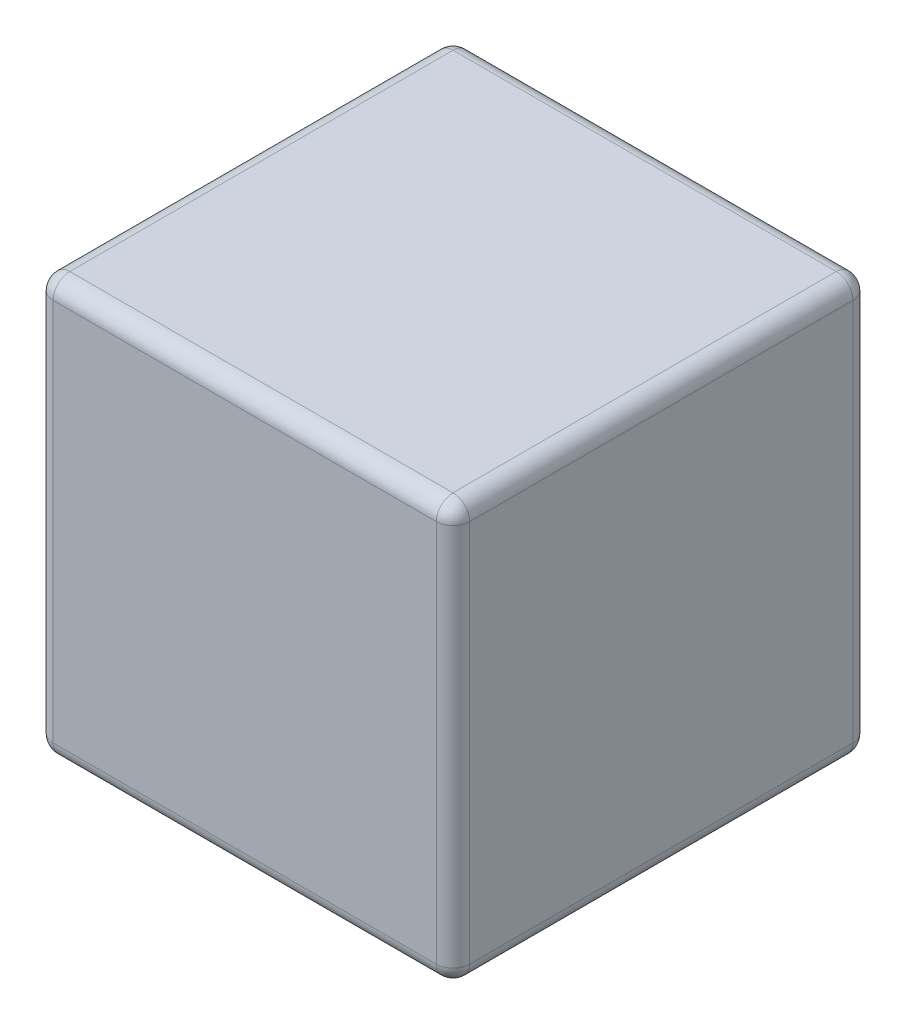
from build123d import *

# Parameters (mm, degrees)
SKETCH1_W           = 250
SKETCH1_H           = 250
BOSS_EXTRUDE1_DEPTH = 125
FILLET1_R           = 10
SKETCH2_W           = 2.243589744
SKETCH2_H           = 25
CUT_EXTRUDE1_DEPTH  = 15


with BuildPart() as part:
    # Sketch1 → Boss-Extrude1 (new, symmetric)
    with BuildSketch(Plane(origin=(0, 0, 0), x_dir=(1, 0, 0), z_dir=(0, 1, 0))):
        Rectangle(SKETCH1_W, SKETCH1_H)
    extrude(amount=BOSS_EXTRUDE1_DEPTH, both=True)

    # Fillet1
    fillet1_edges = [part.edges().sort_by_distance(p)[0] for p in [
        (-125, 0, -125),
        (0, -125, -125),
        (-125, -125, 0),
        (125, 0, -125),
        (125, -125, 0),
        (-125, 0, 125),
        (125, 0, 125),
        (0, -125, 125),
        (0, 125, 125),
        (-125, 125, 0),
        (0, 125, -125),
        (125, 125, 0),
    ]]
    fillet(fillet1_edges, radius=FILLET1_R)

    # Sketch2 → Cut-Extrude1 (cut)
    # profile 1 of 11: a face of its own
    with BuildSketch(Plane(origin=(0, 0, -125), x_dir=(-1, 0, 0), z_dir=(0, 0, -1))):
        Polygon((-103.958881832, 105.864219876), (-101.715292089, 105.864219876), (-101.715292089, 83.42832244), (-92.099907473, 83.42832244), (-92.099907473, 80.864219876), (-103.958881832, 80.864219876), align=None)
    # profile 2 of 11: a face of its own
    with BuildSketch(Plane(origin=(0, 0, -125), x_dir=(-1, 0, 0), z_dir=(0, 0, -1))):
        with Locations((-86.811445935, 93.364219876)):
            Rectangle(SKETCH2_W, SKETCH2_H)
    # profile 3 of 11: a face of its own
    with BuildSketch(Plane(origin=(0, 0, -125), x_dir=(-1, 0, 0), z_dir=(0, 0, -1))):
        Polygon((-79.279394653, 105.864219876), (-67.099907473, 105.864219876), (-67.099907473, 103.300117312), (-77.035804909, 103.300117312), (-77.035804909, 95.60780962), (-67.099907473, 95.60780962), (-67.099907473, 93.043707055), (-77.035804909, 93.043707055), (-77.035804909, 80.864219876), (-79.279394653, 80.864219876), align=None)
    # profile 4 of 11: a face of its own
    with BuildSketch(Plane(origin=(0, 0, -125), x_dir=(-1, 0, 0), z_dir=(0, 0, -1))):
        Polygon((-62.612727986, 105.864219876), (-48.510163884, 105.864219876), (-48.510163884, 103.300117312), (-60.369138243, 103.300117312), (-60.369138243, 95.60780962), (-48.510163884, 95.60780962), (-48.510163884, 93.043707055), (-60.369138243, 93.043707055), (-60.369138243, 83.42832244), (-48.510163884, 83.42832244), (-48.510163884, 80.864219876), (-62.612727986, 80.864219876), align=None)
    # profile 5 of 11: a face of its own
    with BuildSketch(Plane(origin=(0, 0, -125), x_dir=(-1, 0, 0), z_dir=(0, 0, -1))):
        with BuildLine():
            Line((-36.971702345, 85.686936222), (-34.858320935, 86.953963466))
            add(Edge.make_bspline(
                [(-34.858320935, 86.953963466), (-34.661762098, 86.624932145), (-34.28516295, 85.994520831), (-33.656938956, 85.142677685), (-33.005989591, 84.41866228), (-32.327494351, 83.826686512), (-31.625594722, 83.360623035), (-30.895708624, 83.030607094), (-30.14029569, 82.824778698), (-29.626196965, 82.79977808), (-29.369538884, 82.787296799)],
                knots=[0, 0, 0, 0, 1.272034388, 2.437168799, 3.508375237, 4.49857839, 5.41946034, 6.295179144, 7.148887113, 8, 8, 8, 8], degree=3))
            add(Edge.make_bspline(
                [(-29.369538884, 82.787296799), (-29.150347023, 82.793401603), (-28.715798644, 82.80550439), (-28.076068337, 82.921795833), (-27.45476975, 83.100453897), (-26.864708051, 83.356317694), (-26.314025091, 83.665878306), (-25.831120124, 84.039779574), (-25.413647887, 84.458395329), (-25.072154211, 84.925414291), (-24.810153959, 85.427679638), (-24.608782042, 85.943222147), (-24.497031516, 86.480140492), (-24.480197563, 86.841643798), (-24.471702345, 87.024075645)],
                knots=[0, 0, 0, 0, 1.095163259, 2.171163733, 3.241058638, 4.321873601, 5.38011039, 6.391990106, 7.366004449, 8.327778327, 9.272591725, 10.192022065, 11.087607919, 12, 12, 12, 12], degree=3))
            add(Edge.make_bspline(
                [(-24.471702345, 87.024075645), (-24.482233136, 87.232224572), (-24.503640695, 87.655360923), (-24.684579838, 88.279644158), (-24.969217315, 88.89744823), (-25.231807628, 89.279600127), (-25.36813664, 89.478001927)],
                knots=[0, 0, 0, 0, 0.938893495, 1.908633276, 2.914225137, 4, 4, 4, 4], degree=3))
            add(Edge.make_bspline(
                [(-25.36813664, 89.478001927), (-25.480069599, 89.621193524), (-25.715058844, 89.921806371), (-26.119041076, 90.369272339), (-26.59308475, 90.830832474), (-27.120967285, 91.324111453), (-27.72191792, 91.826167143), (-28.377114451, 92.360940557), (-29.103284872, 92.908094679), (-29.612566991, 93.275041576), (-29.875348179, 93.464380132)],
                knots=[0, 0, 0, 0, 0.722233717, 1.516239348, 2.393582979, 3.351407094, 4.387010283, 5.505090956, 6.712668013, 8, 8, 8, 8], degree=3))
            add(Edge.make_bspline(
                [(-29.875348179, 93.464380132), (-30.138376723, 93.651727187), (-30.64126727, 94.009920489), (-31.344542858, 94.541522517), (-31.973431879, 95.027550157), (-32.52513914, 95.472578815), (-32.999421975, 95.876668848), (-33.400017768, 96.235939842), (-33.716721747, 96.560108134), (-33.892833038, 96.770403432), (-33.971902666, 96.864820837)],
                knots=[0, 0, 0, 0, 1.452282411, 2.77665338, 3.964542531, 5.026858415, 5.96415736, 6.766646006, 7.446254459, 8, 8, 8, 8], degree=3))
            add(Edge.make_bspline(
                [(-33.971902666, 96.864820837), (-34.082420846, 97.011971101), (-34.29976968, 97.301361842), (-34.586669719, 97.753682255), (-34.830520882, 98.216705579), (-35.021680397, 98.69167604), (-35.182653389, 99.171925532), (-35.290924322, 99.663720144), (-35.358720014, 100.164853133), (-35.365662775, 100.502092423), (-35.369138243, 100.670910581)],
                knots=[0, 0, 0, 0, 1.068054152, 2.10047183, 3.106115577, 4.101338837, 5.06977816, 6.043150881, 7.020423561, 8, 8, 8, 8], degree=3))
            add(Edge.make_bspline(
                [(-35.369138243, 100.670910581), (-35.359815321, 100.935408971), (-35.341368749, 101.458752283), (-35.185365055, 102.223258215), (-34.9391301, 102.953161195), (-34.594166615, 103.641235007), (-34.149471237, 104.269563442), (-33.634857135, 104.845374064), (-33.021917947, 105.329435365), (-32.34939921, 105.752378639), (-31.613282266, 106.083420962), (-30.841918671, 106.333142249), (-30.034082442, 106.474636947), (-29.486917194, 106.494942411), (-29.209282473, 106.505245517)],
                knots=[0, 0, 0, 0, 1.005424448, 1.989358655, 2.955360095, 3.929531133, 4.905563448, 5.876582895, 6.856512386, 7.866279853, 8.892233794, 9.918561126, 10.94386622, 12, 12, 12, 12], degree=3))
            add(Edge.make_bspline(
                [(-29.209282473, 106.505245517), (-28.914681757, 106.495084434), (-28.328814959, 106.474877283), (-27.467034848, 106.299180631), (-26.637315445, 106.008461547), (-25.969863553, 105.678542561), (-25.447486686, 105.349032449), (-25.049110024, 105.048890847), (-24.645413947, 104.703354357), (-24.233142126, 104.311502599), (-23.819280273, 103.869740092), (-23.397684186, 103.381092314), (-22.96736798, 102.848545486), (-22.690540408, 102.468370481), (-22.548625422, 102.273474684)],
                knots=[0, 0, 0, 0, 1.286793592, 2.559021753, 3.825965368, 5.121522368, 5.803751409, 6.523245864, 7.299691795, 8.125521123, 9.008227632, 9.944561021, 10.946284179, 12, 12, 12, 12], degree=3))
            Line((-22.548625422, 102.273474684), (-24.576870614, 100.736014748))
            add(Edge.make_bspline(
                [(-24.576870614, 100.736014748), (-24.699341561, 100.893791108), (-24.935191968, 101.197631488), (-25.293259732, 101.623140885), (-25.630750074, 102.011830025), (-25.96325293, 102.349438082), (-26.27320744, 102.65445332), (-26.574043456, 102.91559444), (-26.861431679, 103.135420122), (-27.223695327, 103.370016979), (-27.678821886, 103.602563433), (-28.250140002, 103.799342562), (-28.847184824, 103.917593004), (-29.253825049, 103.933227915), (-29.459683114, 103.941142953)],
                knots=[0, 0, 0, 0, 1.181633172, 2.275549214, 3.290209073, 4.226197932, 5.078386478, 5.862611352, 6.581680152, 7.217281963, 8.414376989, 9.595101626, 10.782541182, 12, 12, 12, 12], degree=3))
            add(Edge.make_bspline(
                [(-29.459683114, 103.941142953), (-29.717943989, 103.932487953), (-30.215975756, 103.915797602), (-30.923048871, 103.733511992), (-31.55943405, 103.446498705), (-32.106238086, 103.044248861), (-32.561502208, 102.567670342), (-32.890826913, 102.019249948), (-33.089042375, 101.413661358), (-33.113230086, 100.991220956), (-33.125548499, 100.77607885)],
                knots=[0, 0, 0, 0, 1.14458467, 2.207223713, 3.21896685, 4.227309161, 5.202851033, 6.127160689, 7.046193047, 8, 8, 8, 8], degree=3))
            add(Edge.make_bspline(
                [(-33.125548499, 100.77607885), (-33.122740452, 100.642139718), (-33.117119765, 100.374042436), (-33.038728353, 99.977960851), (-32.938018861, 99.582879855), (-32.778428634, 99.190575692), (-32.558105037, 98.794187413), (-32.268782352, 98.386889287), (-31.904401551, 97.965091368), (-31.625280034, 97.690752984), (-31.477912281, 97.545910581)],
                knots=[0, 0, 0, 0, 0.858281714, 1.717966888, 2.583508476, 3.4729293, 4.427298488, 5.488583878, 6.674047936, 8, 8, 8, 8], degree=3))
            add(Edge.make_bspline(
                [(-31.477912281, 97.545910581), (-31.423188193, 97.497074682), (-31.293176284, 97.381051766), (-31.055491101, 97.191106904), (-30.74161397, 96.956801388), (-30.359741105, 96.666891984), (-29.902831378, 96.330595826), (-29.370834549, 95.952212882), (-28.769680743, 95.519459604), (-28.343095629, 95.216905742), (-28.117535679, 95.056928209)],
                knots=[0, 0, 0, 0, 0.420754252, 0.999615792, 1.744751191, 2.668019286, 3.750313428, 4.999500688, 6.413464383, 8, 8, 8, 8], degree=3))
            add(Edge.make_bspline(
                [(-28.117535679, 95.056928209), (-27.846207726, 94.859489927), (-27.320818752, 94.477178057), (-26.57326461, 93.902780343), (-25.895451695, 93.341010567), (-25.285000241, 92.795456231), (-24.735879466, 92.270255566), (-24.254181462, 91.759089993), (-23.834998031, 91.265621616), (-23.383717899, 90.632960361), (-22.922590616, 89.855952617), (-22.526579849, 88.903965198), (-22.276877367, 87.948277195), (-22.244223686, 87.305942649), (-22.228112602, 86.989019555)],
                knots=[0, 0, 0, 0, 1.163667725, 2.253281268, 3.268753668, 4.215851969, 5.092017293, 5.902905408, 6.650798638, 7.335211899, 8.59617414, 9.77448103, 10.901945474, 12, 12, 12, 12], degree=3))
            add(Edge.make_bspline(
                [(-22.228112602, 86.989019555), (-22.232806445, 86.764888376), (-22.242102982, 86.320978494), (-22.348966651, 85.669156516), (-22.505535688, 85.036078875), (-22.741515931, 84.429570929), (-23.02953849, 83.83853691), (-23.395011689, 83.278480479), (-23.818638008, 82.737006203), (-24.304593472, 82.228552693), (-24.836349917, 81.761794151), (-25.398376308, 81.346586569), (-25.991592543, 81.000384259), (-26.612780519, 80.717878244), (-27.262082924, 80.496924547), (-27.93928138, 80.336832625), (-28.645492175, 80.238577547), (-29.125495614, 80.228379251), (-29.369538884, 80.223194235)],
                knots=[0, 0, 0, 0, 0.983748083, 1.948392443, 2.894712957, 3.844097841, 4.80183111, 5.778335162, 6.776009319, 7.81870978, 8.863265674, 9.881300176, 10.883814829, 11.87499822, 12.874611388, 13.892143829, 14.928324115, 16, 16, 16, 16], degree=3))
            add(Edge.make_bspline(
                [(-29.369538884, 80.223194235), (-29.558362762, 80.226845532), (-29.933632477, 80.234102142), (-30.488700205, 80.298254145), (-31.032554413, 80.389019171), (-31.558370713, 80.53311967), (-32.072923654, 80.707955221), (-32.573975329, 80.923229025), (-33.061768571, 81.181209035), (-33.53903702, 81.476173497), (-34.004566838, 81.819443101), (-34.453991609, 82.21925379), (-34.90205722, 82.664578826), (-35.335538622, 83.167511421), (-35.763203939, 83.719926299), (-36.17662115, 84.326991894), (-36.584347704, 84.985401564), (-36.840172475, 85.448723605), (-36.971702345, 85.686936222)],
                knots=[0, 0, 0, 0, 0.915332311, 1.819136955, 2.706846663, 3.586547465, 4.459518054, 5.340707479, 6.227863349, 7.133153174, 8.059268498, 9.028702269, 10.047606654, 11.120612155, 12.245963614, 13.433783089, 14.680604001, 16, 16, 16, 16], degree=3))
        make_face()
    # profile 6 of 11: a face of its own
    with BuildSketch(Plane(origin=(0, 0, -125), x_dir=(-1, 0, 0), z_dir=(0, 0, -1))):
        with BuildLine():
            Line((-17.099907473, 105.864219876), (-14.85631773, 105.864219876))
            Line((-14.85631773, 105.864219876), (-14.85631773, 90.88525353))
            add(Edge.make_bspline(
                [(-14.85631773, 90.88525353), (-14.856651615, 90.673248274), (-14.857285221, 90.270931768), (-14.853052979, 89.69830105), (-14.841200347, 89.189212056), (-14.833727779, 88.741702431), (-14.817103968, 88.357825663), (-14.80354649, 88.035502016), (-14.786113942, 87.776257712), (-14.765163103, 87.624965383), (-14.756157473, 87.559933017)],
                knots=[0, 0, 0, 0, 1.528628734, 2.90083645, 4.128790002, 5.200304208, 6.127813768, 6.898992206, 7.526736466, 8, 8, 8, 8], degree=3))
            add(Edge.make_bspline(
                [(-14.756157473, 87.559933017), (-14.719175625, 87.325313279), (-14.647295722, 86.869293785), (-14.46410731, 86.219948915), (-14.208268017, 85.634724213), (-13.905103426, 85.095357848), (-13.505584774, 84.616862419), (-13.026988093, 84.176064899), (-12.447146889, 83.790552008), (-11.802428277, 83.43804621), (-11.107533724, 83.154724193), (-10.39745325, 82.940485876), (-9.682860541, 82.809922306), (-9.204459362, 82.794804171), (-8.966894653, 82.787296799)],
                knots=[0, 0, 0, 0, 1.035780045, 2.013197591, 2.933192213, 3.817615948, 4.702609284, 5.640816605, 6.646850145, 7.73207398, 8.84249596, 9.914020372, 10.964143139, 12, 12, 12, 12], degree=3))
            add(Edge.make_bspline(
                [(-8.966894653, 82.787296799), (-8.762939364, 82.794967158), (-8.356206779, 82.810263575), (-7.751875132, 82.904988082), (-7.163302927, 83.075706408), (-6.587583785, 83.295990397), (-6.047933896, 83.587044619), (-5.544052167, 83.923264901), (-5.09430978, 84.317628301), (-4.68389551, 84.754059333), (-4.326503111, 85.246486476), (-4.016709242, 85.784187462), (-3.762952602, 86.375254226), (-3.63764171, 86.790642956), (-3.573264845, 87.004043594)],
                knots=[0, 0, 0, 0, 0.994687771, 1.983630487, 2.973142513, 3.978332533, 4.983357753, 5.956394766, 6.925816176, 7.893390482, 8.871859704, 9.88551698, 10.913711441, 12, 12, 12, 12], degree=3))
            add(Edge.make_bspline(
                [(-3.573264845, 87.004043594), (-3.551835379, 87.092247696), (-3.504081892, 87.288801983), (-3.459460142, 87.621096915), (-3.41298496, 88.013163801), (-3.380738032, 88.467819606), (-3.349300743, 88.983540839), (-3.33049308, 89.563014107), (-3.321799988, 90.204135256), (-3.319209414, 90.651543554), (-3.317856191, 90.88525353)],
                knots=[0, 0, 0, 0, 0.558680831, 1.244966039, 2.062412453, 2.990489873, 4.051219941, 5.244515665, 6.560634259, 8, 8, 8, 8], degree=3))
            Line((-3.317856191, 90.88525353), (-3.317856191, 105.864219876))
            Line((-3.317856191, 105.864219876), (-1.074266448, 105.864219876))
            Line((-1.074266448, 105.864219876), (-1.074266448, 90.765061222))
            add(Edge.make_bspline(
                [(-1.074266448, 90.765061222), (-1.076081593, 90.492929944), (-1.07962396, 89.961849209), (-1.110342364, 89.183625216), (-1.159320934, 88.445389635), (-1.228521563, 87.747043231), (-1.320214443, 87.091084951), (-1.422180303, 86.471765178), (-1.552034111, 85.893529517), (-1.703701262, 85.351869391), (-1.877083748, 84.83625858), (-2.101663379, 84.346911333), (-2.354695522, 83.868951335), (-2.654800185, 83.409607701), (-2.992024347, 82.966846607), (-3.373822067, 82.543353214), (-3.787566073, 82.132360026), (-4.240134356, 81.744409554), (-4.724066679, 81.38863329), (-5.237923519, 81.075792068), (-5.777757589, 80.811337658), (-6.342165633, 80.593652483), (-6.931388511, 80.429976775), (-7.54544108, 80.308011376), (-8.185721032, 80.238709251), (-8.621182862, 80.228409751), (-8.841694332, 80.223194235)],
                knots=[0, 0, 0, 0, 1.316592851, 2.569410997, 3.76748051, 4.895814652, 5.963796859, 6.97159953, 7.931736103, 8.829262218, 9.692595152, 10.560224239, 11.431080259, 12.30701507, 13.211635791, 14.121146779, 15.063487852, 16.031507147, 17.00238618, 17.966455255, 18.938106653, 19.907068911, 20.888905087, 21.893141452, 22.933117798, 24, 24, 24, 24], degree=3))
            add(Edge.make_bspline(
                [(-8.841694332, 80.223194235), (-9.082187923, 80.228799701), (-9.554035486, 80.239797606), (-10.249307395, 80.302817249), (-10.915837369, 80.421520066), (-11.560665062, 80.572662521), (-12.17501147, 80.781117787), (-12.767107501, 81.024675822), (-13.326812366, 81.32379911), (-13.863206142, 81.65660906), (-14.3619544, 82.031070761), (-14.819792994, 82.439214861), (-15.237477784, 82.874503271), (-15.607968472, 83.341648741), (-15.937403362, 83.837018076), (-16.221190601, 84.362012646), (-16.46485663, 84.91642919), (-16.590617823, 85.301809193), (-16.654194332, 85.496631735)],
                knots=[0, 0, 0, 0, 1.13879206, 2.234305948, 3.301075583, 4.341971843, 5.366689343, 6.369221514, 7.369726634, 8.367512178, 9.355451585, 10.318319045, 11.268648973, 12.207971039, 13.137398894, 14.081662264, 15.030215811, 16, 16, 16, 16], degree=3))
            add(Edge.make_bspline(
                [(-16.654194332, 85.496631735), (-16.691174034, 85.629721552), (-16.771383829, 85.918396331), (-16.857278812, 86.396156963), (-16.929486538, 86.946263518), (-16.997383383, 87.568753649), (-17.037447368, 88.264109839), (-17.07257193, 89.032030667), (-17.100154922, 89.873444679), (-17.099992262, 90.459548362), (-17.099907473, 90.765061222)],
                knots=[0, 0, 0, 0, 0.625038921, 1.35572334, 2.194682327, 3.136881307, 4.189498639, 5.346923369, 6.617055217, 8, 8, 8, 8], degree=3))
            Line((-17.099907473, 90.765061222), (-17.099907473, 105.864219876))
        make_face()
    # profile 7 of 11: a face of its own
    with BuildSketch(Plane(origin=(0, 0, -125), x_dir=(-1, 0, 0), z_dir=(0, 0, -1))):
        with BuildLine():
            Line((5.335989962, 105.864219876), (10.238834514, 105.864219876))
            add(Edge.make_bspline(
                [(10.238834514, 105.864219876), (10.576055272, 105.863849189), (11.222185221, 105.863138935), (12.148721333, 105.841605036), (12.990219416, 105.81284295), (13.744864994, 105.772972284), (14.41497998, 105.725853782), (14.99753212, 105.659767787), (15.497100379, 105.590765676), (15.796432161, 105.520612772), (15.932945091, 105.488618914)],
                knots=[0, 0, 0, 0, 1.415646017, 2.712440637, 3.8905458, 4.950247383, 5.884950622, 6.709939814, 7.411656543, 8, 8, 8, 8], degree=3))
            add(Edge.make_bspline(
                [(15.932945091, 105.488618914), (16.105756046, 105.441319273), (16.447305883, 105.347834546), (16.939456191, 105.160593664), (17.407697945, 104.938578199), (17.853637648, 104.685550057), (18.271795384, 104.39065317), (18.668409962, 104.065841615), (19.03998125, 103.703616125), (19.384419764, 103.308039412), (19.700739747, 102.885752198), (19.973094623, 102.430450556), (20.201146245, 101.949798389), (20.396741041, 101.444130023), (20.537515716, 100.909199141), (20.643565, 100.348722624), (20.710876625, 99.762760551), (20.717323495, 99.362332926), (20.720605347, 99.158490709)],
                knots=[0, 0, 0, 0, 0.999701418, 1.975846123, 2.934577507, 3.890451536, 4.834027766, 5.787354733, 6.749476667, 7.726910423, 8.712836071, 9.690891519, 10.682875813, 11.679750201, 12.712814741, 13.765529915, 14.8625177, 16, 16, 16, 16], degree=3))
            add(Edge.make_bspline(
                [(20.720605347, 99.158490709), (20.71759517, 98.952935161), (20.711705557, 98.550751847), (20.641017804, 97.962374788), (20.54580215, 97.400100573), (20.399394633, 96.865175927), (20.207639825, 96.360777566), (19.982696591, 95.879197338), (19.711385659, 95.428628253), (19.399636876, 95.007434556), (19.052839773, 94.615220897), (18.672461643, 94.254829507), (18.260038126, 93.928369947), (17.816879925, 93.63511035), (17.338666719, 93.38185121), (16.832651336, 93.155013318), (16.294435505, 92.964505742), (15.921988976, 92.864291017), (15.732624578, 92.813338466)],
                knots=[0, 0, 0, 0, 1.121902311, 2.195077645, 3.232258892, 4.234102512, 5.217864754, 6.176164875, 7.132989551, 8.084763148, 9.034132444, 9.988522005, 10.94243251, 11.903244335, 12.886203696, 13.894208494, 14.929344452, 16, 16, 16, 16], degree=3))
            add(Edge.make_bspline(
                [(15.732624578, 92.813338466), (15.576000764, 92.780031458), (15.232750568, 92.707037214), (14.66744541, 92.625548237), (14.009264082, 92.555993946), (13.259104939, 92.503842963), (12.417641333, 92.459197474), (11.484418066, 92.423711089), (10.457603229, 92.404212133), (9.741380057, 92.40320647), (9.367440283, 92.402681414)],
                knots=[0, 0, 0, 0, 0.601384939, 1.31797006, 2.144135048, 3.087295005, 4.142315834, 5.309527816, 6.595305764, 8, 8, 8, 8], degree=3))
            Line((9.367440283, 92.402681414), (7.579579706, 92.402681414))
            Line((7.579579706, 92.402681414), (7.579579706, 80.864219876))
            Line((7.579579706, 80.864219876), (5.335989962, 80.864219876))
            Line((5.335989962, 80.864219876), (5.335989962, 105.864219876))
        make_face()
        with BuildLine():
            Line((7.579579706, 103.300117312), (7.579579706, 94.966783979))
            Line((7.579579706, 94.966783979), (11.956582911, 94.911695837))
            add(Edge.make_bspline(
                [(11.956582911, 94.911695837), (12.170296667, 94.911585383), (12.582866666, 94.911372154), (13.17883969, 94.939838036), (13.73176317, 94.972698983), (14.239938709, 95.020812722), (14.703595384, 95.088821704), (15.123506304, 95.157476975), (15.496415468, 95.256800994), (15.932838337, 95.390537202), (16.419147962, 95.618627314), (16.94820188, 95.949697957), (17.396563211, 96.371703016), (17.784551045, 96.846187525), (18.092450173, 97.374038449), (18.317850119, 97.938816569), (18.450286957, 98.53472978), (18.468045483, 98.9425022), (18.477015603, 99.148474684)],
                knots=[0, 0, 0, 0, 1.160613943, 2.240541288, 3.23993089, 4.169200891, 5.011653406, 5.7853311, 6.478053781, 7.106038997, 8.262395093, 9.384106736, 10.481365981, 11.59014053, 12.70357646, 13.786202915, 14.881775077, 16, 16, 16, 16], degree=3))
            add(Edge.make_bspline(
                [(18.477015603, 99.148474684), (18.4679967, 99.349464065), (18.450068236, 99.749006081), (18.31681207, 100.334568657), (18.0928884, 100.893395117), (17.782484153, 101.41463144), (17.405761797, 101.887408612), (16.967909346, 102.298102376), (16.469957479, 102.628257396), (16.006755829, 102.841352265), (15.595318786, 102.971461375), (15.237947644, 103.06249595), (14.834442826, 103.135178851), (14.384672972, 103.194032443), (13.892124159, 103.244414309), (13.352564767, 103.27859986), (12.768038744, 103.298610262), (12.362248952, 103.2996028), (12.151895411, 103.300117312)],
                knots=[0, 0, 0, 0, 1.120700087, 2.227813068, 3.331159281, 4.466773991, 5.599788987, 6.693661531, 7.80175334, 8.91857717, 9.525282508, 10.207424825, 10.974604443, 11.810962634, 12.737642355, 13.736264703, 14.826523623, 16, 16, 16, 16], degree=3))
            Line((12.151895411, 103.300117312), (7.579579706, 103.300117312))
        make_face(mode=Mode.SUBTRACT)
    # profile 8 of 11: a face of its own
    with BuildSketch(Plane(origin=(0, 0, -125), x_dir=(-1, 0, 0), z_dir=(0, 0, -1))):
        with BuildLine():
            Line((25.848810475, 105.864219876), (30.751655027, 105.864219876))
            add(Edge.make_bspline(
                [(30.751655027, 105.864219876), (31.088875785, 105.863849189), (31.735005733, 105.863138935), (32.661541846, 105.841605036), (33.503039929, 105.81284295), (34.257685507, 105.772972284), (34.927800493, 105.725853782), (35.510352633, 105.659767787), (36.009920892, 105.590765676), (36.309252674, 105.520612772), (36.445765603, 105.488618914)],
                knots=[0, 0, 0, 0, 1.415646017, 2.712440637, 3.8905458, 4.950247383, 5.884950622, 6.709939814, 7.411656543, 8, 8, 8, 8], degree=3))
            add(Edge.make_bspline(
                [(36.445765603, 105.488618914), (36.618576559, 105.441319273), (36.960126396, 105.347834546), (37.452276704, 105.160593664), (37.920518458, 104.938578199), (38.366458161, 104.685550057), (38.784615897, 104.39065317), (39.181230475, 104.065841615), (39.552801763, 103.703616125), (39.897240277, 103.308039412), (40.213560259, 102.885752198), (40.485915136, 102.430450556), (40.713966758, 101.949798389), (40.909561554, 101.444130023), (41.050336229, 100.909199141), (41.156385512, 100.348722624), (41.223697138, 99.762760551), (41.230144008, 99.362332926), (41.23342586, 99.158490709)],
                knots=[0, 0, 0, 0, 0.999701418, 1.975846123, 2.934577507, 3.890451536, 4.834027766, 5.787354733, 6.749476667, 7.726910423, 8.712836071, 9.690891519, 10.682875813, 11.679750201, 12.712814741, 13.765529915, 14.8625177, 16, 16, 16, 16], degree=3))
            add(Edge.make_bspline(
                [(41.23342586, 99.158490709), (41.230415683, 98.952935161), (41.224526069, 98.550751847), (41.153838317, 97.962374788), (41.058622663, 97.400100573), (40.912215146, 96.865175927), (40.720460338, 96.360777566), (40.495517103, 95.879197338), (40.224206172, 95.428628253), (39.912457389, 95.007434556), (39.565660286, 94.615220897), (39.185282156, 94.254829507), (38.772858638, 93.928369947), (38.329700438, 93.63511035), (37.851487232, 93.38185121), (37.345471849, 93.155013318), (36.807256018, 92.964505742), (36.434809489, 92.864291017), (36.245445091, 92.813338466)],
                knots=[0, 0, 0, 0, 1.121902311, 2.195077645, 3.232258892, 4.234102512, 5.217864754, 6.176164875, 7.132989551, 8.084763148, 9.034132444, 9.988522005, 10.94243251, 11.903244335, 12.886203696, 13.894208494, 14.929344452, 16, 16, 16, 16], degree=3))
            add(Edge.make_bspline(
                [(36.245445091, 92.813338466), (36.088821276, 92.780031458), (35.745571081, 92.707037214), (35.180265923, 92.625548237), (34.522084594, 92.555993946), (33.771925452, 92.503842963), (32.930461846, 92.459197474), (31.997238579, 92.423711089), (30.970423742, 92.404212133), (30.25420057, 92.40320647), (29.880260796, 92.402681414)],
                knots=[0, 0, 0, 0, 0.601384939, 1.31797006, 2.144135048, 3.087295005, 4.142315834, 5.309527816, 6.595305764, 8, 8, 8, 8], degree=3))
            Line((29.880260796, 92.402681414), (28.092400219, 92.402681414))
            Line((28.092400219, 92.402681414), (28.092400219, 80.864219876))
            Line((28.092400219, 80.864219876), (25.848810475, 80.864219876))
            Line((25.848810475, 80.864219876), (25.848810475, 105.864219876))
        make_face()
        with BuildLine():
            Line((28.092400219, 103.300117312), (28.092400219, 94.966783979))
            Line((28.092400219, 94.966783979), (32.469403424, 94.911695837))
            add(Edge.make_bspline(
                [(32.469403424, 94.911695837), (32.68311718, 94.911585383), (33.095687179, 94.911372154), (33.691660202, 94.939838036), (34.244583683, 94.972698983), (34.752759222, 95.020812722), (35.216415896, 95.088821704), (35.636326817, 95.157476975), (36.00923598, 95.256800994), (36.44565885, 95.390537202), (36.931968475, 95.618627314), (37.461022393, 95.949697957), (37.909383724, 96.371703016), (38.297371558, 96.846187525), (38.605270686, 97.374038449), (38.830670631, 97.938816569), (38.96310747, 98.53472978), (38.980865996, 98.9425022), (38.989836116, 99.148474684)],
                knots=[0, 0, 0, 0, 1.160613943, 2.240541288, 3.23993089, 4.169200891, 5.011653406, 5.7853311, 6.478053781, 7.106038997, 8.262395093, 9.384106736, 10.481365981, 11.59014053, 12.70357646, 13.786202915, 14.881775077, 16, 16, 16, 16], degree=3))
            add(Edge.make_bspline(
                [(38.989836116, 99.148474684), (38.980817213, 99.349464065), (38.962888749, 99.749006081), (38.829632583, 100.334568657), (38.605708913, 100.893395117), (38.295304666, 101.41463144), (37.918582309, 101.887408612), (37.480729859, 102.298102376), (36.982777992, 102.628257396), (36.519576342, 102.841352265), (36.108139299, 102.971461375), (35.750768157, 103.06249595), (35.347263339, 103.135178851), (34.897493485, 103.194032443), (34.404944672, 103.244414309), (33.86538528, 103.27859986), (33.280859256, 103.298610262), (32.875069465, 103.2996028), (32.664715924, 103.300117312)],
                knots=[0, 0, 0, 0, 1.120700087, 2.227813068, 3.331159281, 4.466773991, 5.599788987, 6.693661531, 7.80175334, 8.91857717, 9.525282508, 10.207424825, 10.974604443, 11.810962634, 12.737642355, 13.736264703, 14.826523623, 16, 16, 16, 16], degree=3))
            Line((32.664715924, 103.300117312), (28.092400219, 103.300117312))
        make_face(mode=Mode.SUBTRACT)
    # profile 9 of 11: a face of its own
    with BuildSketch(Plane(origin=(0, 0, -125), x_dir=(-1, 0, 0), z_dir=(0, 0, -1))):
        with BuildLine():
            add(Edge.make_bspline(
                [(58.060348937, 106.505245517), (58.523263979, 106.493520664), (59.432467314, 106.470492086), (60.768716584, 106.294212775), (62.044395836, 105.989245704), (63.269896827, 105.583081543), (64.430560946, 105.041264505), (65.535124463, 104.386370588), (66.580959276, 103.61153874), (67.553969145, 102.722758548), (68.444375932, 101.755733878), (69.228846549, 100.723748806), (69.886291504, 99.633043075), (70.426189983, 98.486894285), (70.849751481, 97.287894513), (71.142030365, 96.029651637), (71.328731437, 94.720318136), (71.350558419, 93.827269102), (71.361630988, 93.374235902)],
                knots=[0, 0, 0, 0, 1.065120563, 2.091984664, 3.0946048, 4.079830382, 5.057816894, 6.036188127, 7.030412546, 8.04752943, 9.064399622, 10.05169764, 11.02544977, 11.989514704, 12.962713494, 13.945757189, 14.957906945, 16, 16, 16, 16], degree=3))
            add(Edge.make_bspline(
                [(71.361630988, 93.374235902), (71.350560041, 92.924539856), (71.328737923, 92.038136853), (71.141818084, 90.737112252), (70.848668084, 89.48646442), (70.430123325, 88.288281186), (69.892798479, 87.141298587), (69.230975828, 86.048534631), (68.451395752, 85.009631071), (67.564203958, 84.035969177), (66.597053658, 83.1431301), (65.55969461, 82.365138131), (64.47545661, 81.695680098), (63.330387266, 81.161510999), (62.139672717, 80.73456871), (60.892656124, 80.443478495), (59.595180738, 80.255713901), (58.710387854, 80.234153072), (58.26066945, 80.223194235)],
                knots=[0, 0, 0, 0, 1.043624062, 2.057103931, 3.04512605, 4.022047818, 4.998200453, 5.980619268, 6.982898556, 8.009068085, 9.034988726, 10.034168286, 11.015286542, 11.987931943, 12.962482838, 13.94673481, 14.956375938, 16, 16, 16, 16], degree=3))
            add(Edge.make_bspline(
                [(58.26066945, 80.223194235), (57.8076386, 80.234261284), (56.9145942, 80.256077383), (55.603615376, 80.443087418), (54.344488634, 80.735525302), (53.140814697, 81.153449846), (51.991922343, 81.693572923), (50.895564609, 82.352175631), (49.856142129, 83.13365521), (48.882272511, 84.020559315), (47.99120681, 84.9860704), (47.214354126, 86.020600794), (46.555603317, 87.103854056), (46.017293799, 88.238836371), (45.59111909, 89.420060961), (45.300370389, 90.655407229), (45.112256445, 91.937832271), (45.09057897, 92.81099583), (45.079579706, 93.254043594)],
                knots=[0, 0, 0, 0, 1.053102029, 2.075944431, 3.073151272, 4.055350789, 5.033113405, 6.020478099, 7.024410459, 8.052272461, 9.079885166, 10.07527673, 11.055994387, 12.023226415, 12.992069828, 13.970394897, 14.97016774, 16, 16, 16, 16], degree=3))
            add(Edge.make_bspline(
                [(45.079579706, 93.254043594), (45.083398531, 93.551419802), (45.090988005, 94.142420684), (45.182357237, 95.020039257), (45.314940817, 95.883543955), (45.504954478, 96.730479298), (45.753466385, 97.558772046), (46.046695152, 98.374134637), (46.404836905, 99.168304093), (46.809698676, 99.945042605), (47.261568734, 100.692241932), (47.76068123, 101.398524669), (48.28950529, 102.069817503), (48.869243816, 102.688724673), (49.480789853, 103.27325079), (50.134063983, 103.814413055), (50.825080014, 104.317091276), (51.556811298, 104.770093712), (52.311227547, 105.179801817), (53.088918817, 105.531386467), (53.879322899, 105.833144049), (54.686141813, 106.077721372), (55.507233042, 106.270807343), (56.344388646, 106.402288441), (57.196941691, 106.493890712), (57.771308255, 106.501444297), (58.060348937, 106.505245517)],
                knots=[0, 0, 0, 0, 1.037015668, 2.060948919, 3.074880161, 4.083647147, 5.086022904, 6.090072063, 7.104153813, 8.122640571, 9.144368836, 10.147691507, 11.138137339, 12.123020368, 13.103399296, 14.087645067, 15.080126199, 16.082011238, 17.087798457, 18.072939717, 19.057185487, 20.037253025, 21.01195951, 21.997135196, 22.992090687, 24, 24, 24, 24], degree=3))
        make_face()
        with BuildLine():
            add(Edge.make_bspline(
                [(58.170525219, 103.941142953), (57.933277836, 103.93825088), (57.461051173, 103.932494382), (56.759018771, 103.856667842), (56.066219243, 103.748597206), (55.382509514, 103.594443487), (54.710750304, 103.384414538), (54.04468001, 103.142693765), (53.390372482, 102.848257404), (52.749987783, 102.51559523), (52.129165818, 102.147388653), (51.543360807, 101.74044746), (50.991056208, 101.304314929), (50.473604303, 100.837973234), (49.992524502, 100.339047507), (49.538348063, 99.815101534), (49.129279622, 99.251159455), (48.754382645, 98.662513692), (48.418898072, 98.049930969), (48.120574109, 97.419860524), (47.876545475, 96.767162762), (47.677528502, 96.098918779), (47.512529853, 95.416186924), (47.408001823, 94.713788004), (47.331342113, 93.99525149), (47.325914646, 93.509666818), (47.32316945, 93.26405962)],
                knots=[0, 0, 0, 0, 1.008559885, 2.007477868, 2.99961109, 3.989939068, 4.984837346, 5.991145699, 7.001802488, 8.033829008, 9.059044045, 10.069351652, 11.065060232, 12.050310815, 13.029377138, 14.011219647, 14.996725999, 15.989392538, 16.977580475, 17.965360261, 18.951710183, 19.937753436, 20.929683414, 21.935841486, 22.955955122, 24, 24, 24, 24], degree=3))
            add(Edge.make_bspline(
                [(47.32316945, 93.26405962), (47.332275606, 92.9029009), (47.350190234, 92.192389969), (47.507030021, 91.151188941), (47.748615552, 90.150558325), (48.104739598, 89.195973258), (48.550101132, 88.279228381), (49.100293205, 87.408456205), (49.752143816, 86.583421388), (50.492597578, 85.809883752), (51.302045482, 85.103842293), (52.161564981, 84.48410366), (53.061947892, 83.959744733), (54.005542197, 83.532565644), (54.987310333, 83.194067517), (56.013578555, 82.962077295), (57.077510409, 82.809395471), (57.802729374, 82.794732929), (58.170525219, 82.787296799)],
                knots=[0, 0, 0, 0, 1.032063989, 2.030389145, 3.003944642, 3.970395727, 4.937377036, 5.913328081, 6.909231446, 7.93887556, 8.970685674, 9.976071282, 10.964166581, 11.944589148, 12.933237628, 13.927779006, 14.949070134, 16, 16, 16, 16], degree=3))
            add(Edge.make_bspline(
                [(58.170525219, 82.787296799), (58.417735945, 82.790693259), (58.908029062, 82.797429459), (59.637282793, 82.86527715), (60.353398591, 82.974076218), (61.055372018, 83.130723758), (61.742406386, 83.326775232), (62.417369265, 83.559687575), (63.073071339, 83.850267601), (63.717784466, 84.171324398), (64.334900478, 84.537325523), (64.924011423, 84.930455164), (65.470268422, 85.365945312), (65.987333218, 85.825358258), (66.470388139, 86.317957172), (66.916166598, 86.843101613), (67.323167542, 87.404106308), (67.69792216, 87.991859206), (68.03223118, 88.606118154), (68.323510459, 89.238472996), (68.570625572, 89.887366635), (68.770114892, 90.553735002), (68.926439619, 91.236312494), (69.034153332, 91.936013052), (69.109499322, 92.651436927), (69.115178445, 93.135321612), (69.118041244, 93.379243914)],
                knots=[0, 0, 0, 0, 1.047197238, 2.076906641, 3.100256066, 4.114471768, 5.12198147, 6.126382909, 7.136867548, 8.15857795, 9.17633901, 10.174870724, 11.156907918, 12.133735059, 13.104061851, 14.077631395, 15.04955518, 16.038496417, 17.029181396, 18.010275684, 18.986308667, 19.968651475, 20.955262928, 21.950658345, 22.966943676, 24, 24, 24, 24], degree=3))
            add(Edge.make_bspline(
                [(69.118041244, 93.379243914), (69.115176152, 93.621497516), (69.109492713, 94.10205216), (69.034189322, 94.812486577), (68.92632582, 95.507152374), (68.770877905, 96.183322395), (68.570519664, 96.841169003), (68.323467304, 97.480074343), (68.032143737, 98.102418594), (67.697799277, 98.706663572), (67.321971966, 99.286483129), (66.9112988, 99.840786076), (66.45868917, 100.3591628), (65.977074707, 100.854410614), (65.454425526, 101.315966969), (64.89310914, 101.743984973), (64.299940013, 102.148794075), (63.671888331, 102.51397666), (63.023717233, 102.851221179), (62.358617533, 103.140156916), (61.684123964, 103.385672055), (61.001951734, 103.595078948), (60.306359031, 103.747993449), (59.602045968, 103.856765234), (58.889986978, 103.93246799), (58.411106837, 103.938242122), (58.170525219, 103.941142953)],
                knots=[0, 0, 0, 0, 1.02996197, 2.043119294, 3.035359645, 4.018872909, 4.991431989, 5.957985074, 6.929999688, 7.912076566, 8.892894881, 9.867085534, 10.843653904, 11.817741046, 12.803660682, 13.806313499, 14.818574707, 15.856120519, 16.894564902, 17.924820532, 18.937903209, 19.946497019, 20.957711757, 21.963978472, 22.977135795, 24, 24, 24, 24], degree=3))
        make_face(mode=Mode.SUBTRACT)
    # profile 10 of 11: a face of its own
    with BuildSketch(Plane(origin=(0, 0, -125), x_dir=(-1, 0, 0), z_dir=(0, 0, -1))):
        with BuildLine():
            Line((76.489836116, 105.864219876), (81.492840924, 105.864219876))
            add(Edge.make_bspline(
                [(81.492840924, 105.864219876), (81.826706128, 105.863108547), (82.467764302, 105.860974674), (83.386144805, 105.849076367), (84.220624069, 105.814973826), (84.970765778, 105.785626802), (85.636556171, 105.732112935), (86.220036819, 105.680965456), (86.718520373, 105.614010736), (87.020276453, 105.551829143), (87.156903424, 105.523675004)],
                knots=[0, 0, 0, 0, 1.410062039, 2.707475311, 3.878576406, 4.937260626, 5.877586885, 6.699081471, 7.410979367, 8, 8, 8, 8], degree=3))
            add(Edge.make_bspline(
                [(87.156903424, 105.523675004), (87.339807882, 105.478483823), (87.70171495, 105.389065511), (88.22278685, 105.200068362), (88.719317735, 104.981356758), (89.189245052, 104.724473041), (89.630214989, 104.427510329), (90.046774352, 104.095595169), (90.440813376, 103.730543699), (90.796396449, 103.323151974), (91.131675389, 102.895748334), (91.414451293, 102.433578642), (91.658211862, 101.950282017), (91.852286984, 101.440943319), (92.008558223, 100.910502091), (92.118745647, 100.354153543), (92.184825559, 99.774432292), (92.191553098, 99.379018658), (92.194964321, 99.178522761)],
                knots=[0, 0, 0, 0, 1.027469482, 2.033020251, 3.019912614, 3.986113645, 4.951240523, 5.91722682, 6.890402269, 7.87763091, 8.8651537, 9.85103654, 10.82876324, 11.815024772, 12.821070561, 13.842952187, 14.906261191, 16, 16, 16, 16], degree=3))
            add(Edge.make_bspline(
                [(92.194964321, 99.178522761), (92.184471478, 98.84541487), (92.163997222, 98.1954351), (91.973103624, 97.25214309), (91.660414198, 96.372219414), (91.229533562, 95.556772), (90.680823021, 94.821695962), (90.021360228, 94.176049853), (89.250777288, 93.635764763), (88.533425032, 93.261101872), (87.899752177, 93.021152525), (87.378085657, 92.85232139), (86.809035818, 92.721878781), (86.198054856, 92.605020697), (85.542600174, 92.516794308), (84.84424275, 92.452175776), (84.102484524, 92.411789714), (83.592919743, 92.405775393), (83.330781629, 92.402681414)],
                knots=[0, 0, 0, 0, 1.260483769, 2.459530307, 3.627416485, 4.787058657, 5.939039949, 7.08810263, 8.267026773, 9.491475466, 10.141966685, 10.831826277, 11.566392101, 12.351337768, 13.187381173, 14.07005841, 15.007169909, 16, 16, 16, 16], degree=3))
            Line((83.330781629, 92.402681414), (92.515477142, 80.864219876))
            Line((92.515477142, 80.864219876), (89.741038039, 80.864219876))
            Line((89.741038039, 80.864219876), (80.556342527, 92.402681414))
            Line((80.556342527, 92.402681414), (78.73342586, 92.402681414))
            Line((78.73342586, 92.402681414), (78.73342586, 80.864219876))
            Line((78.73342586, 80.864219876), (76.489836116, 80.864219876))
            Line((76.489836116, 80.864219876), (76.489836116, 105.864219876))
        make_face()
        with BuildLine():
            Line((78.73342586, 103.300117312), (78.73342586, 94.966783979))
            Line((78.73342586, 94.966783979), (83.310749578, 94.931727889))
            add(Edge.make_bspline(
                [(83.310749578, 94.931727889), (83.524464142, 94.931633341), (83.938703835, 94.931450081), (84.537994298, 94.959977054), (85.095995096, 94.992429328), (85.610571897, 95.04206751), (86.081954578, 95.106039451), (86.50990753, 95.186060767), (86.895129329, 95.279289786), (87.344404603, 95.423587113), (87.846094113, 95.652201529), (88.391318826, 95.984812234), (88.855621239, 96.403163085), (89.247891684, 96.881544914), (89.563101909, 97.40751812), (89.785330868, 97.9747779), (89.926348313, 98.5690036), (89.942980781, 98.977418656), (89.951374578, 99.183530773)],
                knots=[0, 0, 0, 0, 1.146690395, 2.22261258, 3.21895312, 4.145990853, 4.996080663, 5.770904154, 6.481378293, 7.121626537, 8.300444488, 9.431385265, 10.535395872, 11.636531494, 12.74115979, 13.810798291, 14.895190096, 16, 16, 16, 16], degree=3))
            add(Edge.make_bspline(
                [(89.951374578, 99.183530773), (89.942787999, 99.384577729), (89.925772532, 99.782979433), (89.786852757, 100.366235935), (89.551928604, 100.916714151), (89.23534119, 101.432174758), (88.849632941, 101.900072871), (88.39736285, 102.300409679), (87.89089717, 102.630762998), (87.417531468, 102.841865716), (86.99442995, 102.971293239), (86.627075235, 103.06237298), (86.211993252, 103.135547758), (85.747168547, 103.194176765), (85.23458547, 103.244569224), (84.671652248, 103.2785105), (84.062103818, 103.298609529), (83.639625738, 103.299603021), (83.42092586, 103.300117312)],
                knots=[0, 0, 0, 0, 1.101028733, 2.181837193, 3.264309656, 4.369019818, 5.486613113, 6.575447106, 7.666700264, 8.788928104, 9.402425223, 10.0903467, 10.862060571, 11.710948788, 12.657782767, 13.684531032, 14.801375019, 16, 16, 16, 16], degree=3))
            Line((83.42092586, 103.300117312), (78.73342586, 103.300117312))
        make_face(mode=Mode.SUBTRACT)
    # profile 11 of 11: a face of its own
    with BuildSketch(Plane(origin=(0, 0, -125), x_dir=(-1, 0, 0), z_dir=(0, 0, -1))):
        Polygon((94.759066886, 103.300117312), (94.759066886, 105.864219876), (107.900092527, 105.864219876), (107.900092527, 103.300117312), (102.451374578, 103.300117312), (102.451374578, 80.864219876), (100.207784834, 80.864219876), (100.207784834, 103.300117312), align=None)
    extrude(amount=-CUT_EXTRUDE1_DEPTH, mode=Mode.SUBTRACT)


solid = part.part
